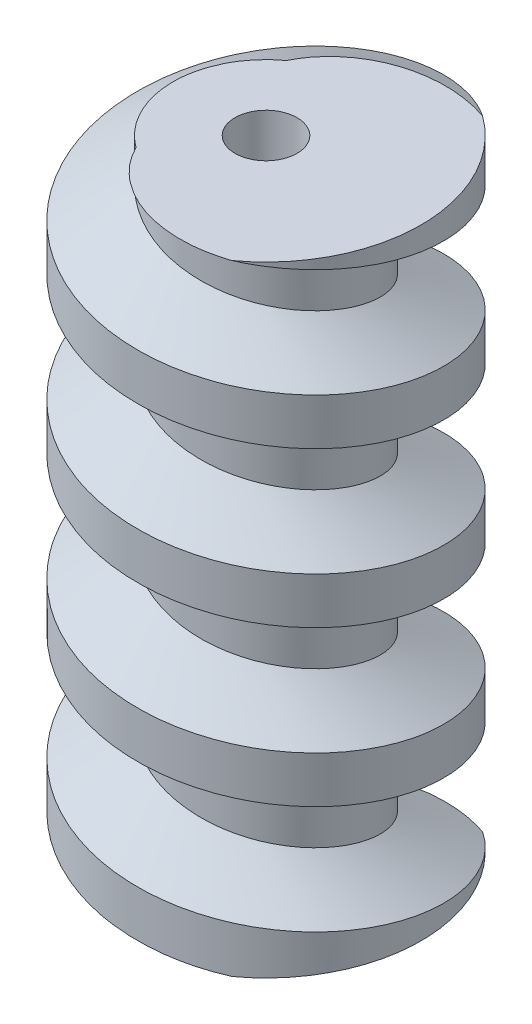
from build123d import *

# Parameters (mm, degrees)
SKETCH1_R           = 10
BOSS_EXTRUDE1_DEPTH = 40
CUT_SWEEP1_PITCH    = 10
SKETCH4_R           = 2
CUT_EXTRUDE1_DEPTH  = 40


with BuildPart() as part:
    # Sketch1 → Boss-Extrude1 (new body)
    with BuildSketch(Plane(origin=(0, 0, 0), x_dir=(1, 0, 0), z_dir=(0, 1, 0))):
        with Locations(Location((0, 0, 0), (0, 0, 270))):
            Circle(SKETCH1_R)
    extrude(amount=BOSS_EXTRUDE1_DEPTH)

    # Cut-Sweep1: arcs per turn and ends read off the stored shape
    # Cut-Sweep1: the profile of Sketch3 screwed along a left-hand helix through 5.5 turns, 16 arcs to a turn; built about Z, then put on its axis
    cut_sweep1_z = Axis((0, 0, 0), (0, 0, 1))
    cut_sweep1_corners = [(6, 0, -11.5), (6, 0, -8.5), (10, 0, -6.5), (10.703756793, 0, -6.5), (10.703756793, 0, -13.5), (10, 0, -13.5)]
    with BuildLine(mode=Mode.PRIVATE) as cut_sweep1_profile:
        Line(cut_sweep1_corners[0], cut_sweep1_corners[1])
        Line(cut_sweep1_corners[1], cut_sweep1_corners[2])
        Line(cut_sweep1_corners[2], cut_sweep1_corners[3])
        Line(cut_sweep1_corners[3], cut_sweep1_corners[4])
        Line(cut_sweep1_corners[4], cut_sweep1_corners[5])
        Line(cut_sweep1_corners[5], cut_sweep1_corners[0])
    cut_sweep1_cap = Face(cut_sweep1_profile.wire())
    cut_sweep1_turn_angles = [0, -11.25, -22.5, -33.75, -45, -56.25, -67.5, -78.75, -90, -101.25, -112.5, -123.75, -135, -146.25, -157.5, -168.75, -180, -191.25, -202.5, -213.75, -225, -236.25, -247.5, -258.75, -270, -281.25, -292.5, -303.75, -315, -326.25, -337.5, -348.75, -360]
    cut_sweep1_turn_weights = [1, 0.9807852804032304, 1, 0.9807852804032304, 1, 0.9807852804032304, 1, 0.9807852804032304, 1, 0.9807852804032304, 1, 0.9807852804032304, 1, 0.9807852804032304, 1, 0.9807852804032304, 1, 0.9807852804032304, 1, 0.9807852804032304, 1, 0.9807852804032304, 1, 0.9807852804032304, 1, 0.9807852804032304, 1, 0.9807852804032304, 1, 0.9807852804032304, 1, 0.9807852804032304, 1]
    cut_sweep1_turn_rails = [Edge.make_bspline([Vector(p[0], p[1], 0).rotate(cut_sweep1_z, cut_sweep1_turn_angles[k]) / cut_sweep1_turn_weights[k] + Vector(0, 0, p[2] + -CUT_SWEEP1_PITCH * cut_sweep1_turn_angles[k] / 360) for k in range(33)], [0, 0, 0, 1, 1, 2, 2, 3, 3, 4, 4, 5, 5, 6, 6, 7, 7, 8, 8, 9, 9, 10, 10, 11, 11, 12, 12, 13, 13, 14, 14, 15, 15, 16, 16, 16], 2, cut_sweep1_turn_weights) for p in cut_sweep1_corners]
    cut_sweep1_turn_sides = [Face.make_surface_from_curves(cut_sweep1_turn_rails[p[0]], cut_sweep1_turn_rails[p[1]]) for p in [(0, 1), (1, 2), (2, 3), (3, 4), (4, 5), (5, 0)]]
    cut_sweep1_last_angles = [-1800, -1811.25, -1822.5, -1833.75, -1845, -1856.25, -1867.5, -1878.75, -1890, -1901.25, -1912.5, -1923.75, -1935, -1946.25, -1957.5, -1968.75, -1980]
    cut_sweep1_last_weights = [1, 0.9807852804032304, 1, 0.9807852804032304, 1, 0.9807852804032304, 1, 0.9807852804032304, 1, 0.9807852804032304, 1, 0.9807852804032304, 1, 0.9807852804032304, 1, 0.9807852804032304, 1]
    cut_sweep1_last_rails = [Edge.make_bspline([Vector(p[0], p[1], 0).rotate(cut_sweep1_z, cut_sweep1_last_angles[k]) / cut_sweep1_last_weights[k] + Vector(0, 0, p[2] + -CUT_SWEEP1_PITCH * cut_sweep1_last_angles[k] / 360) for k in range(17)], [0, 0, 0, 1, 1, 2, 2, 3, 3, 4, 4, 5, 5, 6, 6, 7, 7, 8, 8, 8], 2, cut_sweep1_last_weights) for p in cut_sweep1_corners]
    cut_sweep1_last_sides = [Face.make_surface_from_curves(cut_sweep1_last_rails[p[0]], cut_sweep1_last_rails[p[1]]) for p in [(0, 1), (1, 2), (2, 3), (3, 4), (4, 5), (5, 0)]]
    cut_sweep1 = Plane(origin=(0, 0, 0), x_dir=(-1, 0, 0), z_dir=(0, 1, 0)) * Solid(Shell([*[p.moved(Location((0, 0, CUT_SWEEP1_PITCH * i))) for i in range(5) for p in cut_sweep1_turn_sides], *cut_sweep1_last_sides, cut_sweep1_cap, cut_sweep1_cap.rotate(cut_sweep1_z, -1980).moved(Location((0, 0, -CUT_SWEEP1_PITCH * -1980 / 360)))]))
    add(cut_sweep1, mode=Mode.SUBTRACT)

    # Sketch4 → Cut-Extrude1 (cut)
    with BuildSketch(Plane.XZ):
        with Locations(Location((0, 0, 0), (0, 0, 270))):
            Circle(SKETCH4_R)
    extrude(amount=-CUT_EXTRUDE1_DEPTH, mode=Mode.SUBTRACT)


solid = part.part
